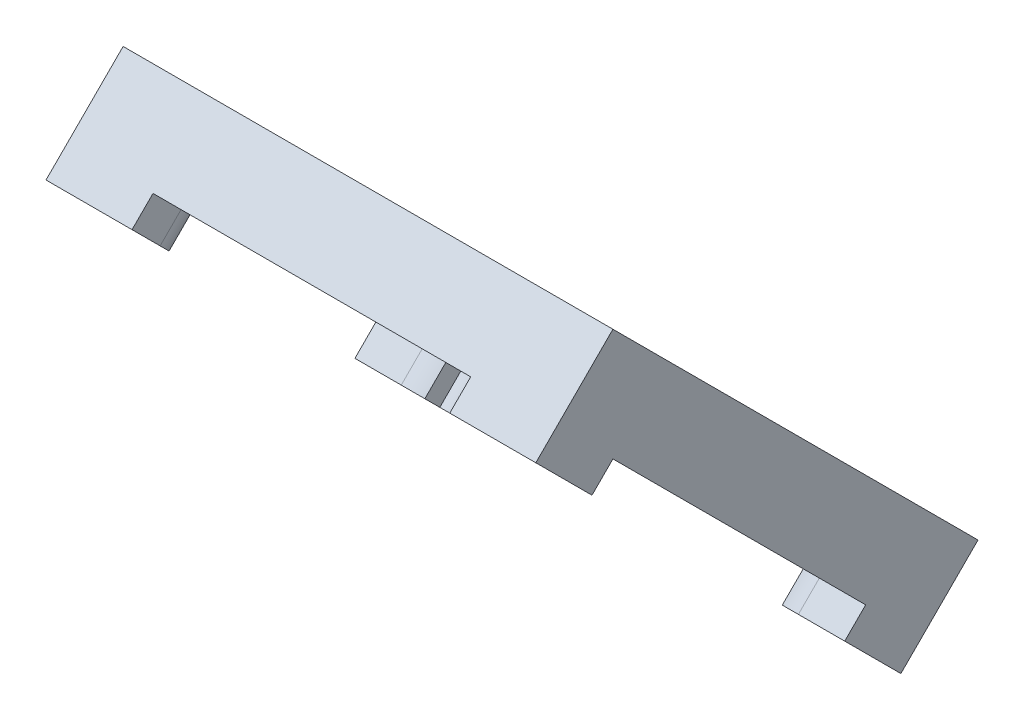
from build123d import *
from OCP.BRepAlgoAPI import BRepAlgoAPI_Cut
from OCP.TopTools import TopTools_ListOfShape

# Parameters (mm, degrees)
SKETCH3_W               = 37
SKETCH3_H               = 39
SKETCH3_R               = 12
BOSS_EXTRUDE1_DEPTH     = 4.5
SKETCH4_W               = 37
SKETCH4_H               = 39
SKETCH4_R               = 13
BOSS_EXTRUDE2_DEPTH     = 1.5
SKETCH5_R               = 1.25
BOSS_EXTRUDE4_DEPTH     = 2.238877686
CUT_EXTRUDE1_DEPTH      = 3
CUT_EXTRUDE1_DEPTH_BACK = 7.261122
SKETCH7_W               = 27
SKETCH7_H               = 10


with BuildPart() as part:
    # Sketch3 → Boss-Extrude1 (new body)
    with BuildSketch(Plane(origin=(0, -51.218608926, 51.218608926), x_dir=(1, 0, 0), z_dir=(-2.4581031654591364e-15, -0.7071067811865478, 0.7071067811865472))):
        with Locations((73.844609768, 127.312236852)):
            Rectangle(SKETCH3_W, SKETCH3_H)
        with Locations(Location((73.844609768, 131.312236852, 0), (0, 0, 270))):
            Circle(SKETCH3_R, mode=Mode.SUBTRACT)
    extrude(amount=-BOSS_EXTRUDE1_DEPTH)

    # Sketch4 → Boss-Extrude2 (add)
    with BuildSketch(Plane(origin=(0, -48.036628411, 48.036628411), x_dir=(1, 0, 0), z_dir=(2.4581031654591364e-15, 0.7071067811865478, -0.7071067811865472))):
        with Locations((73.844609768, -127.312236852)):
            Rectangle(SKETCH4_W, SKETCH4_H)
        with Locations(Location((73.844609768, -131.312236852, 0), (0, 0, 90))):
            Circle(SKETCH4_R, mode=Mode.SUBTRACT)
    extrude(amount=BOSS_EXTRUDE2_DEPTH)

    # Sketch5 → Boss-Extrude4 (add)
    # profile 1 of 4: a face of its own
    with BuildSketch(Plane(origin=(0, -51.218608926, 51.218608926), x_dir=(1, 0, 0), z_dir=(-2.386964886512496e-15, -0.7071067811865477, 0.7071067811865475))):
        with BuildLine():
            Line((92.344609768, 107.812236852), (92.344609768, 113.812236852))
            Line((92.344609768, 113.812236852), (88.844609768, 113.812236852))
            ThreePointArc((88.844609768, 113.812236852), (88.068152632, 113.710014331), (87.344609768, 113.410313064))
            Line((87.344609768, 113.410313064), (87.344609768, 111.807298734))
            Line((87.344609768, 111.807298734), (87.722178544, 111.807298734))
            ThreePointArc((87.722178544, 111.807298734), (90.344606124, 110.815542933), (87.726575779, 109.812236852))
            Line((87.726575779, 109.812236852), (87.344609768, 109.812236852))
            Line((87.344609768, 109.812236852), (87.344609768, 107.812236852))
            Line((87.344609768, 107.812236852), (92.344609768, 107.812236852))
        make_face()
    # profile 2 of 4: a face of its own
    with BuildSketch(Plane(origin=(0, -51.218608926, 51.218608926), x_dir=(1, 0, 0), z_dir=(-2.386964886512496e-15, -0.7071067811865477, 0.7071067811865475))):
        with BuildLine():
            Line((55.344609768, 107.812236852), (60.344609768, 107.812236852))
            Line((60.344609768, 107.812236852), (60.344609768, 109.812236852))
            Line((60.344609768, 109.812236852), (59.962643756, 109.812236852))
            ThreePointArc((59.962643756, 109.812236852), (57.344609768, 110.812236852), (59.962643756, 111.812236852))
            Line((59.962643756, 111.812236852), (60.344609768, 111.812236852))
            Line((60.344609768, 111.812236852), (60.344609768, 113.410313064))
            ThreePointArc((60.344609768, 113.410313064), (59.621066903, 113.710014331), (58.844609768, 113.812236852))
            Line((58.844609768, 113.812236852), (55.344609768, 113.812236852))
            Line((55.344609768, 113.812236852), (55.344609768, 107.812236852))
        make_face()
    # profile 3 of 4: a face of its own
    with BuildSketch(Plane(origin=(0, -51.218608926, 51.218608926), x_dir=(1, 0, 0), z_dir=(-2.386964886512496e-15, -0.7071067811865477, 0.7071067811865475))):
        with BuildLine():
            Line((55.344609768, 146.812236852), (55.344609768, 140.812236852))
            Line((55.344609768, 140.812236852), (58.844609768, 140.812236852))
            ThreePointArc((58.844609768, 140.812236852), (60.965930111, 141.690916509), (61.844609768, 143.812236852))
            Line((61.844609768, 143.812236852), (61.844609768, 146.812236852))
            Line((61.844609768, 146.812236852), (55.344609768, 146.812236852))
        make_face()
        with Locations(Location((58.844609768, 143.812236852, 0), (0, 0, 90))):
            Circle(SKETCH5_R, mode=Mode.SUBTRACT)
    # profile 4 of 4: a face of its own
    with BuildSketch(Plane(origin=(0, -51.218608926, 51.218608926), x_dir=(1, 0, 0), z_dir=(-2.386964886512496e-15, -0.7071067811865477, 0.7071067811865475))):
        with BuildLine():
            Line((92.344609768, 146.812236852), (85.844609768, 146.812236852))
            Line((85.844609768, 146.812236852), (85.844609768, 143.812236852))
            ThreePointArc((85.844609768, 143.812236852), (86.723289424, 141.690916509), (88.844609768, 140.812236852))
            Line((88.844609768, 140.812236852), (92.344609768, 140.812236852))
            Line((92.344609768, 140.812236852), (92.344609768, 146.812236852))
        make_face()
        with Locations(Location((88.844609768, 143.812236852, 0), (0, 0, 90))):
            Circle(SKETCH5_R, mode=Mode.SUBTRACT)
    extrude(amount=BOSS_EXTRUDE4_DEPTH)


with BuildPart() as cut_extrude1_tool:
    # Sketch7 → Cut-Extrude1 (new, two sides: drawn at the far end of the back side and taken through both)
    with BuildSketch(Plane(origin=(0, -46.084220099, 46.084220099), x_dir=(1, 0, 0), z_dir=(0, 0.7071067811865502, -0.7071067811865449)).offset(-CUT_EXTRUDE1_DEPTH_BACK)):
        with Locations((73.844609768, -112.812236852)):
            Rectangle(SKETCH7_W, SKETCH7_H)
    extrude(amount=CUT_EXTRUDE1_DEPTH + CUT_EXTRUDE1_DEPTH_BACK)


with BuildPart() as part_1:
    add(part.part)

    # Cut-Extrude1: cut by cut_extrude1_tool, with a tolerance
    cut_extrude1_stock = TopTools_ListOfShape()
    cut_extrude1_stock.Append(part_1.part.wrapped)
    cut_extrude1_tools = TopTools_ListOfShape()
    cut_extrude1_tools.Append(cut_extrude1_tool.part.wrapped)
    cut_extrude1_cut = BRepAlgoAPI_Cut()
    cut_extrude1_cut.SetArguments(cut_extrude1_stock)
    cut_extrude1_cut.SetTools(cut_extrude1_tools)
    cut_extrude1_cut.SetFuzzyValue(0.00001)
    cut_extrude1_cut.Build()
    add(Compound.cast(cut_extrude1_cut.Shape()).solids(), mode=Mode.REPLACE)


solid = part_1.part
